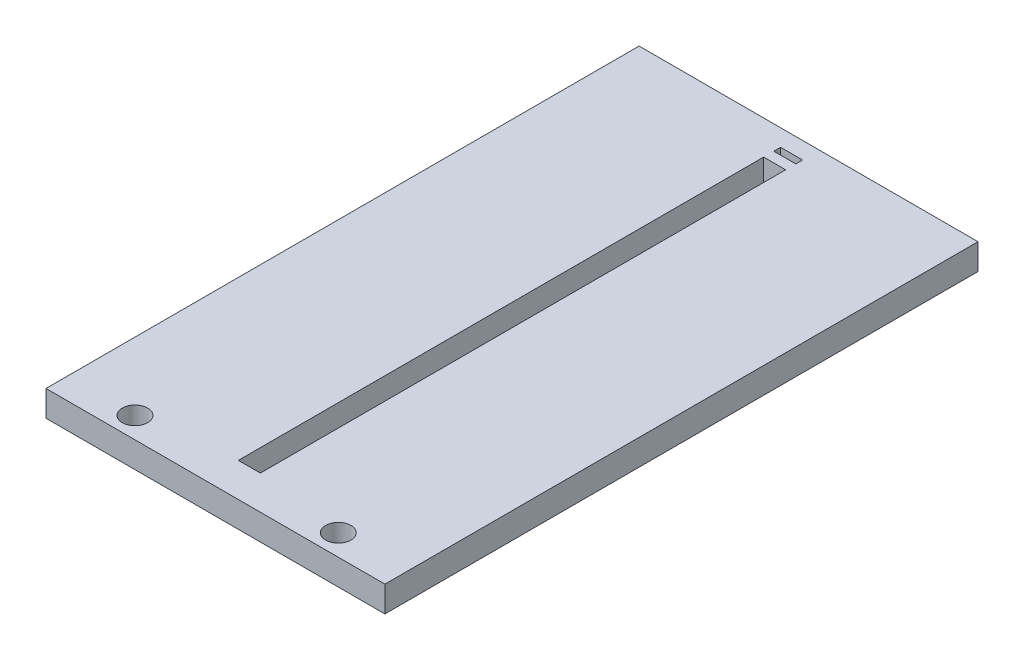
from build123d import *

# Parameters (mm, degrees)
SKETCH1_W           = 40
SKETCH1_H           = 70
BOSS_EXTRUDE1_DEPTH = 3.05
SKETCH4_W           = 2.6
SKETCH4_H           = 0.8
SKETCH4_H_2         = 62
CUT_EXTRUDE1_DEPTH  = 10
SKETCH7_R           = 1.5
CUT_EXTRUDE4_DEPTH  = 10


with BuildPart() as part:
    # Sketch1 → Boss-Extrude1 (new body)
    with BuildSketch(Plane(origin=(0, 0, 0), x_dir=(1, 0, 0), z_dir=(0, 1, 0))):
        with Locations((20, 35)):
            Rectangle(SKETCH1_W, SKETCH1_H)
    extrude(amount=BOSS_EXTRUDE1_DEPTH)

    # Sketch4 → Cut-Extrude1 (cut)
    with BuildSketch(Plane(origin=(0, 3.05, 0), x_dir=(1, 0, 0), z_dir=(0, 1, 0))):
        with Locations((20, 67.6)):
            Rectangle(SKETCH4_W, SKETCH4_H)
        with Locations((20, 35)):
            Rectangle(SKETCH4_W, SKETCH4_H_2)
    extrude(amount=-CUT_EXTRUDE1_DEPTH, mode=Mode.SUBTRACT)

    # Sketch7 → Cut-Extrude4 (cut)
    with BuildSketch(Plane(origin=(0, 3.05, 0), x_dir=(1, 0, 0), z_dir=(0, 1, 0))):
        with Locations((8, 2.5)):
            Circle(SKETCH7_R)
        with Locations((32, 2.5)):
            Circle(SKETCH7_R)
    extrude(amount=-CUT_EXTRUDE4_DEPTH, mode=Mode.SUBTRACT)


solid = part.part
